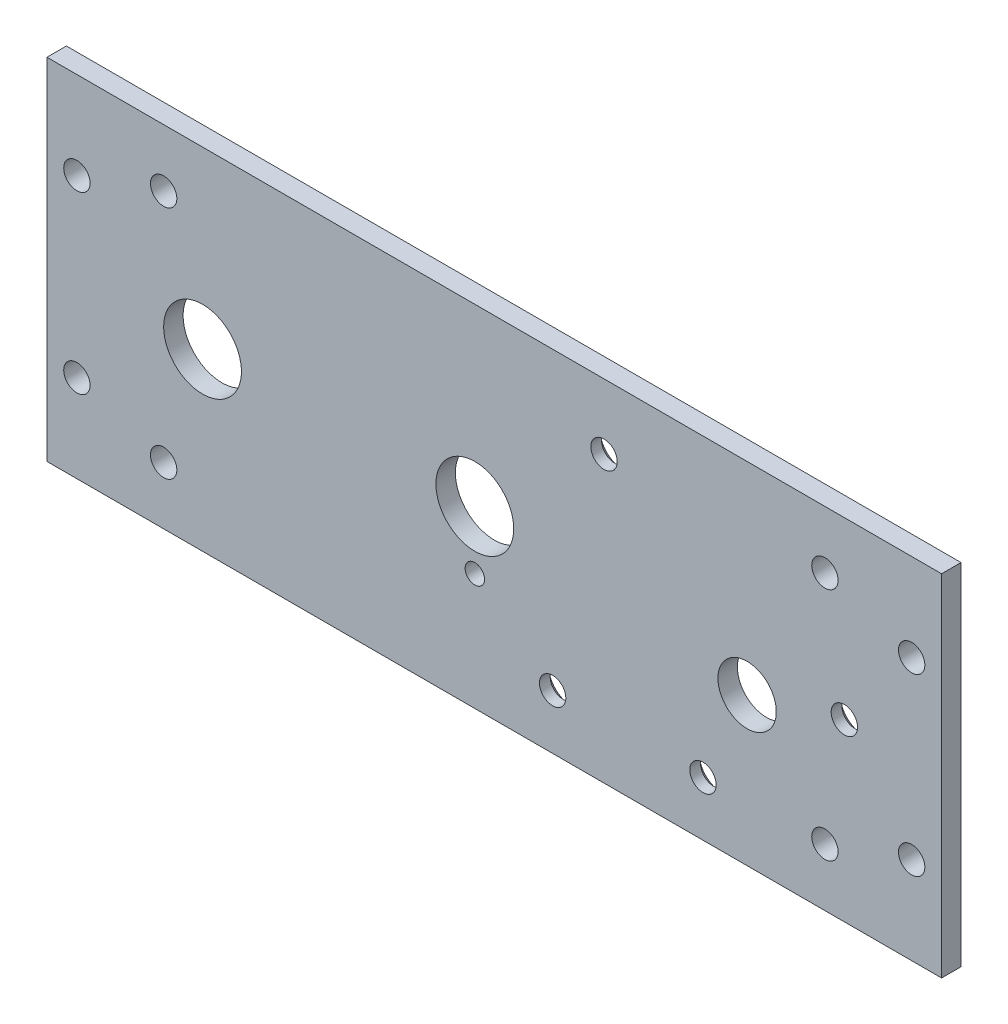
from build123d import *

# Parameters (mm, degrees)
SKETCH1_W                                 = 146.05
SKETCH1_H                                 = 57.15
BOSS_EXTRUDE1_DEPTH                       = 3.175
F_6_CLEARANCE_HOLE1_D                     = 4.3053
F_1_2_0_5_DIAMETER_HOLE1_D                = 12.7
F_3_8_0_375_DIAMETER_HOLE1_D              = 9.525
F_1_8_0_125_DIAMETER_HOLE1_D              = 3.175
CSK_FOR_6_FLAT_HEAD_MACHINE_SCREW_2_COUNT = 2
CSK_FOR_6_FLAT_HEAD_MACHINE_SCREW_2_PITCH = 38.528341037
CSK_FOR_6_FLAT_HEAD_MACHINE_SCREW_3_COUNT = 2
CSK_FOR_6_FLAT_HEAD_MACHINE_SCREW_3_PITCH = 51.534810808
CSK_FOR_6_FLAT_HEAD_MACHINE_SCREW_4_COUNT = 2
CSK_FOR_6_FLAT_HEAD_MACHINE_SCREW_4_PITCH = 24.55


with BuildPart() as part:
    # Sketch1 → Boss-Extrude1 (new body)
    with BuildSketch(Plane.XY):
        with Locations((-73.025, 28.575)):
            Rectangle(SKETCH1_W, SKETCH1_H)
    extrude(amount=-BOSS_EXTRUDE1_DEPTH)

    # #6 Clearance Hole1 (through all)
    with Locations(Plane(origin=(0, 0, -3.175), x_dir=(-1, 0, 0), z_dir=(0, 0, -1))):
        with Locations((4.8895, 42.8625), (141.1605, 42.8625), (141.1605, 14.2875), (4.8895, 14.2875), (19.05, 47.752), (19.05, 9.398), (127, 9.398), (127, 47.752)):
            Hole(F_6_CLEARANCE_HOLE1_D / 2)

    # 1/2 (0.5) Diameter Hole1 (through all)
    with Locations(Plane(origin=(0, 0, -3.175), x_dir=(-1, 0, 0), z_dir=(0, 0, -1))):
        with Locations((76.2, 28.575), (120.65, 28.575)):
            Hole(F_1_2_0_5_DIAMETER_HOLE1_D / 2)

    # 3/8 (0.375) Diameter Hole1 (through all)
    with Locations(Plane(origin=(0, 0, -3.175), x_dir=(-1, 0, 0), z_dir=(0, 0, -1))):
        with Locations((31.75, 24.13)):
            Hole(F_3_8_0_375_DIAMETER_HOLE1_D / 2)

    # 1/8 (0.125) Diameter Hole1 (through all)
    with Locations(Plane(origin=(0, 0, -3.175), x_dir=(-1, 0, 0), z_dir=(0, 0, -1))):
        with Locations((76.2, 19.05)):
            Hole(F_1_8_0_125_DIAMETER_HOLE1_D / 2)

    # Sketch14 → CSK for #6 Flat Head Machine Screw (100)2 (revolve, cut)
    with BuildSketch(Plane(origin=(-63.5, 8.89, -3.175), x_dir=(0, 1, 0), z_dir=(1, 0, 0))):
        Polygon((0, 0), (0, 3.175), (2.15265, 3.175), (2.15265, 1.420893136), (3.8460045, 0), align=None)
    csk_for_6_flat_head_machine_screw_100 = revolve(axis=Axis((-63.5, 8.89, -9.525), (0, 0, 1)), mode=Mode.SUBTRACT)

    # CSK for _6 Flat Head Machine Screw _ 2: CSK for #6 Flat Head Machine Screw (100)2 ×2
    with Locations(*[Vector(0.21781400598375378, 0.9759902964667782, 0) * (i * CSK_FOR_6_FLAT_HEAD_MACHINE_SCREW_2_PITCH) for i in range(1, CSK_FOR_6_FLAT_HEAD_MACHINE_SCREW_2_COUNT)]):
        add(csk_for_6_flat_head_machine_screw_100, mode=Mode.SUBTRACT)

    # CSK for _6 Flat Head Machine Screw _ 3: CSK for #6 Flat Head Machine Screw (100)2 ×2
    with Locations(*[Vector(0.924132625179902, 0.38207184020561197, 0) * (i * CSK_FOR_6_FLAT_HEAD_MACHINE_SCREW_3_PITCH) for i in range(1, CSK_FOR_6_FLAT_HEAD_MACHINE_SCREW_3_COUNT)]):
        add(csk_for_6_flat_head_machine_screw_100, mode=Mode.SUBTRACT)

    # CSK for _6 Flat Head Machine Screw _ 4: CSK for #6 Flat Head Machine Screw (100)2 ×2
    with Locations(*[(i * CSK_FOR_6_FLAT_HEAD_MACHINE_SCREW_4_PITCH, 0, 0) for i in range(1, CSK_FOR_6_FLAT_HEAD_MACHINE_SCREW_4_COUNT)]):
        add(csk_for_6_flat_head_machine_screw_100, mode=Mode.SUBTRACT)


solid = part.part
